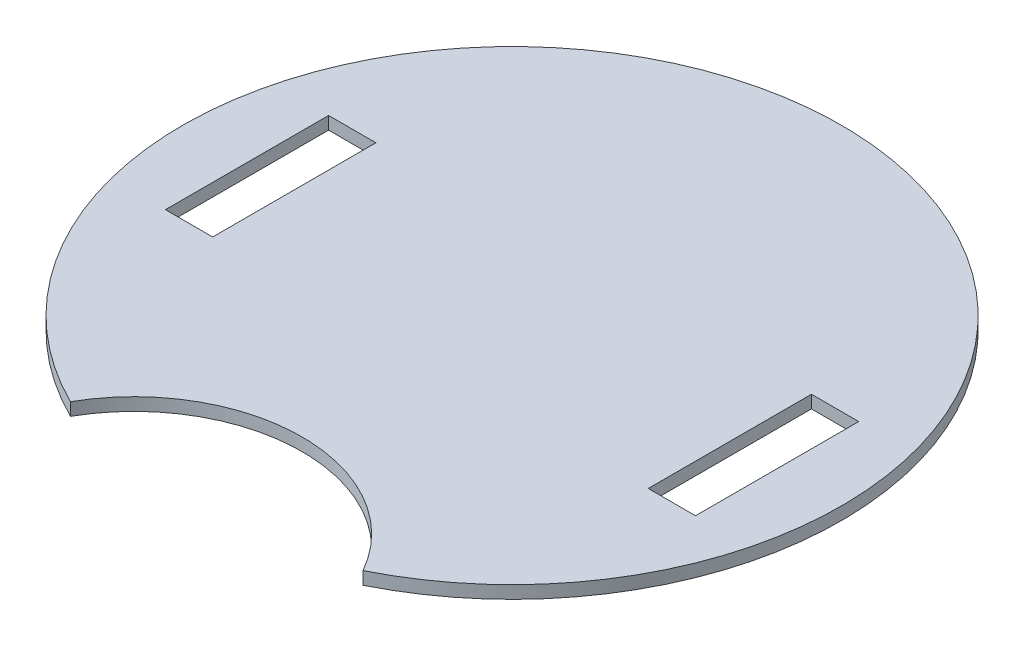
from build123d import *

# Parameters (mm, degrees)
BOSS_EXTRUDE1_DEPTH = 2.9
SKETCH2_W           = 10.76
SKETCH2_H           = 37.139097212
CUT_EXTRUDE1_DEPTH  = 107.105654892


with BuildPart() as part:
    # Sketch1 → Boss-Extrude1 (new body)
    with BuildSketch(Plane(origin=(0, 0, 0), x_dir=(1, 0, 0), z_dir=(0, 1, 0))):
        with BuildLine():
            ThreePointArc((33.29110537, -67.206415641), (0, 75), (-33.29110537, -67.206415641))
            ThreePointArc((-33.29110537, -67.206415641), (0, -47.791616815), (33.29110537, -67.206415641))
        make_face()
    extrude(amount=BOSS_EXTRUDE1_DEPTH)

    # Sketch2 → Cut-Extrude1 (cut, through all)
    with BuildSketch(Plane(origin=(0, 2.9, 0), x_dir=(1, 0, 0), z_dir=(0, 1, 0))):
        with Locations((-54.942668207, 0)):
            Rectangle(SKETCH2_W, SKETCH2_H)
        with Locations((54.942668207, 0)):
            Rectangle(SKETCH2_W, SKETCH2_H)
    extrude(amount=-CUT_EXTRUDE1_DEPTH, mode=Mode.SUBTRACT)


solid = part.part
